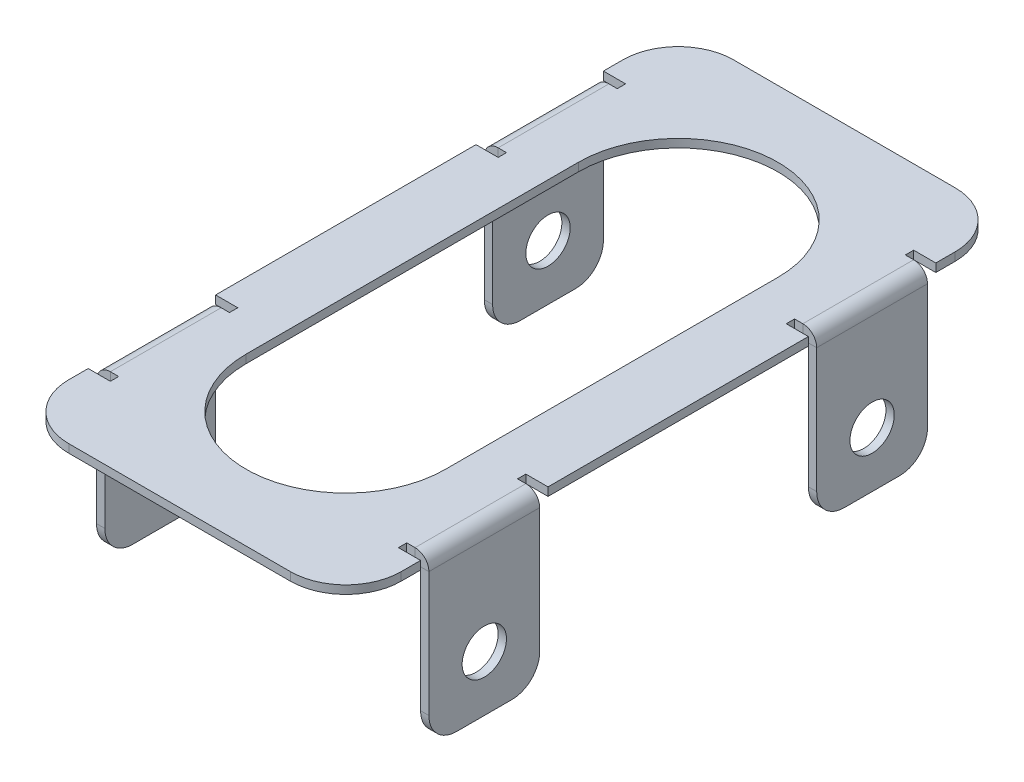
from build123d import *

# Parameters (mm, degrees)
SKETCH1_W                     = 60
SKETCH1_H                     = 120
BASE_FLANGE1_DEPTH            = 1.5
CUT_EXTRUDE1_DEPTH            = 10
BREAK_CORNER1_START           = -1.5
BREAK_CORNER1_DEPTH           = 1.5
EDGE_FLANGE1_STRIP_W          = 8
EDGE_FLANGE1_STRIP_H          = 1.5
EDGE_FLANGE1_STRIP_CUT_DEPTH  = 20
EDGE_FLANGE1_RELIEF_W         = 9.5
EDGE_FLANGE1_RELIEF_H         = 1.5
EDGE_FLANGE1_RELIEF_CUT_DEPTH = 1.5
EDGE_FLANGE1_DEPTH            = 20
SKETCH10_R                    = 4
CUT_EXTRUDE2_DEPTH            = 10
MIRROR2_COPY_1_SKETCH_W       = 8
MIRROR2_COPY_1_SKETCH_H       = 1.5
MIRROR2_COPY_1_DEPTH          = 20
MIRROR2_COPY_2_SKETCH_W       = 9.5
MIRROR2_COPY_2_SKETCH_H       = 1.5
MIRROR2_COPY_2_DEPTH          = 1.5
MIRROR2_COPY_3_DEPTH          = 20
MIRROR2_COPY_4_SKETCH_R       = 4
MIRROR2_COPY_4_DEPTH          = 10
BREAK_CORNER2_START           = -30
BREAK_CORNER2_DEPTH           = 60


# Read off the part's stored shape, not the designer's step: Break-Corner1, Break-Corner2
# Sheet-metal steps are written as plain solids
with BuildPart() as part:
    # Sketch1 → Base-Flange1 (new body)
    with BuildSketch(Plane(origin=(0, 0, 0), x_dir=(1, 0, 0), z_dir=(0, 1, 0))):
        Rectangle(SKETCH1_W, SKETCH1_H)
    extrude(amount=-BASE_FLANGE1_DEPTH)

    # Sketch6 → Cut-Extrude1 (cut)
    with BuildSketch(Plane(origin=(0, 0, 0), x_dir=(1, 0, 0), z_dir=(0, 1, 0))):
        with BuildLine():
            Line((18, 30), (18, -30))
            ThreePointArc((18, -30), (0, -48), (-18, -30))
            Line((-18, -30), (-18, 30))
            ThreePointArc((-18, 30), (0, 48), (18, 30))
        make_face()
    extrude(amount=-CUT_EXTRUDE1_DEPTH, mode=Mode.SUBTRACT)

    # Break-Corner1 outline → Break-Corner1 (cut)
    with BuildSketch(Plane(origin=(0, 0, 0), x_dir=(1, 0, 0), z_dir=(0, 1, 0)).offset(BREAK_CORNER1_START)):
        with BuildLine():
            ThreePointArc((30, -50), (27.071067812, -57.071067812), (20, -60))
            Line((20, -60), (30, -60))
            Line((30, -60), (30, -50))
        make_face()
        with BuildLine():
            Line((-30, -60), (-20, -60))
            ThreePointArc((-20, -60), (-27.071067812, -57.071067812), (-30, -50))
            Line((-30, -50), (-30, -60))
        make_face()
        with BuildLine():
            ThreePointArc((20, 60), (27.071067812, 57.071067812), (30, 50))
            Line((30, 50), (30, 60))
            Line((30, 60), (20, 60))
        make_face()
        with BuildLine():
            Line((-30, 60), (-30, 50))
            ThreePointArc((-30, 50), (-27.071067812, 57.071067812), (-20, 60))
            Line((-20, 60), (-30, 60))
        make_face()
    extrude(amount=BREAK_CORNER1_DEPTH, mode=Mode.SUBTRACT)

    # Edge-Flange1 strip (across the edge) → Edge-Flange1 strip cut (cut)
    with BuildSketch(Plane(origin=(30, -1.5, 25), x_dir=(-1, 0, 0), z_dir=(0, 0, 1))):
        with Locations((-1.5, -0.75)):
            Rectangle(EDGE_FLANGE1_STRIP_W, EDGE_FLANGE1_STRIP_H)
    edge_flange1_strip_cut = extrude(amount=EDGE_FLANGE1_STRIP_CUT_DEPTH, mode=Mode.SUBTRACT)

    # Edge-Flange1 relief (on the sheet) → Edge-Flange1 relief cut (cut)
    with BuildSketch(Plane(origin=(27.5, -1.5, 25), x_dir=(-1, 0, 0), z_dir=(0, -1, 0))):
        with Locations((-3.25, 0.75)):
            Rectangle(EDGE_FLANGE1_RELIEF_W, EDGE_FLANGE1_RELIEF_H)
        with Locations((-3.25, -20.75)):
            Rectangle(EDGE_FLANGE1_RELIEF_W, EDGE_FLANGE1_RELIEF_H)
    edge_flange1_relief_cut = extrude(amount=-EDGE_FLANGE1_RELIEF_CUT_DEPTH, mode=Mode.SUBTRACT)

    # Edge-Flange1 section (across the edge) → Edge-Flange1 (add)
    with BuildSketch(Plane(origin=(30, -1.5, 25), x_dir=(-1, 0, 0), z_dir=(0, 0, 1))):
        with BuildLine():
            Line((0, 1), (0, 28.5))
            Line((0, 28.5), (1.5, 28.5))
            Line((1.5, 28.5), (1.5, 1))
            ThreePointArc((1.5, 1), (1.792893219, 0.292893219), (2.5, 0))
            Line((2.5, 0), (2.5, -1.5))
            ThreePointArc((2.5, -1.5), (0.732233047, -0.767766953), (0, 1))
        make_face()
    edge_flange1 = extrude(amount=EDGE_FLANGE1_DEPTH)

    # Sketch10 → Cut-Extrude2 (cut)
    with BuildSketch(Plane(origin=(30, 0, 0), x_dir=(0, 0, -1), z_dir=(1, 0, 0))):
        with Locations(Location((-35, -20, 0), (0, 0, 90))):
            Circle(SKETCH10_R)
    cut_extrude2 = extrude(amount=-CUT_EXTRUDE2_DEPTH, mode=Mode.SUBTRACT)

    # Mirror1: Edge-Flange1 strip cut, Edge-Flange1 relief cut, Edge-Flange1, Cut-Extrude2 across plane
    add(edge_flange1_strip_cut.mirror(Plane.XY), mode=Mode.SUBTRACT)
    add(edge_flange1_relief_cut.mirror(Plane.XY), mode=Mode.SUBTRACT)
    add(edge_flange1.mirror(Plane.XY))
    add(cut_extrude2.mirror(Plane.XY), mode=Mode.SUBTRACT)

    # Mirror2: Edge-Flange1 strip cut, Edge-Flange1 relief cut, Edge-Flange1, Cut-Extrude2 across plane
    add(edge_flange1_strip_cut.mirror(Plane(origin=(0, 0, 0), x_dir=(0, 0, 1), z_dir=(1, 0, 0))), mode=Mode.SUBTRACT)
    add(edge_flange1_relief_cut.mirror(Plane(origin=(0, 0, 0), x_dir=(0, 0, 1), z_dir=(1, 0, 0))), mode=Mode.SUBTRACT)
    add(edge_flange1.mirror(Plane(origin=(0, 0, 0), x_dir=(0, 0, 1), z_dir=(1, 0, 0))))
    add(cut_extrude2.mirror(Plane(origin=(0, 0, 0), x_dir=(0, 0, 1), z_dir=(1, 0, 0))), mode=Mode.SUBTRACT)

    # Mirror2 copy 1 sketch → Mirror2 copy 1 (cut)
    with BuildSketch(Plane(origin=(-30, -1.5, -25), x_dir=(1, 0, 0), z_dir=(0, 0, -1))):
        with Locations((-1.5, -0.75)):
            Rectangle(MIRROR2_COPY_1_SKETCH_W, MIRROR2_COPY_1_SKETCH_H)
    extrude(amount=MIRROR2_COPY_1_DEPTH, mode=Mode.SUBTRACT)

    # Mirror2 copy 2 sketch → Mirror2 copy 2 (cut)
    with BuildSketch(Plane(origin=(-27.5, -1.5, -25), x_dir=(1, 0, 0), z_dir=(0, -1, 0))):
        with Locations((-3.25, 0.75)):
            Rectangle(MIRROR2_COPY_2_SKETCH_W, MIRROR2_COPY_2_SKETCH_H)
        with Locations((-3.25, -20.75)):
            Rectangle(MIRROR2_COPY_2_SKETCH_W, MIRROR2_COPY_2_SKETCH_H)
    extrude(amount=-MIRROR2_COPY_2_DEPTH, mode=Mode.SUBTRACT)

    # Mirror2 copy 3 sketch → Mirror2 copy 3 (add)
    with BuildSketch(Plane(origin=(-30, -1.5, -25), x_dir=(1, 0, 0), z_dir=(0, 0, -1))):
        with BuildLine():
            Line((0, 1), (0, 28.5))
            Line((0, 28.5), (1.5, 28.5))
            Line((1.5, 28.5), (1.5, 1))
            ThreePointArc((1.5, 1), (1.792893219, 0.292893219), (2.5, 0))
            Line((2.5, 0), (2.5, -1.5))
            ThreePointArc((2.5, -1.5), (0.732233047, -0.767766953), (0, 1))
        make_face()
    extrude(amount=MIRROR2_COPY_3_DEPTH)

    # Mirror2 copy 4 sketch → Mirror2 copy 4 (cut)
    with BuildSketch(Plane.ZY.offset(30)):
        with Locations(Location((-35, -20, 0), (0, 0, 90))):
            Circle(MIRROR2_COPY_4_SKETCH_R)
    extrude(amount=-MIRROR2_COPY_4_DEPTH, mode=Mode.SUBTRACT)

    # Break-Corner2 outline → Break-Corner2 (cut)
    with BuildSketch(Plane.YZ.offset(BREAK_CORNER2_START)):
        with BuildLine():
            Line((-30, 45), (-30, 40))
            ThreePointArc((-30, 40), (-28.535533906, 43.535533906), (-25, 45))
            Line((-25, 45), (-30, 45))
        make_face()
        with BuildLine():
            ThreePointArc((-25, 25), (-28.535533906, 26.464466094), (-30, 30))
            Line((-30, 30), (-30, 25))
            Line((-30, 25), (-25, 25))
        make_face()
        with BuildLine():
            ThreePointArc((-25, -45), (-28.535533906, -43.535533906), (-30, -40))
            Line((-30, -40), (-30, -45))
            Line((-30, -45), (-25, -45))
        make_face()
        with BuildLine():
            Line((-30, -25), (-30, -30))
            ThreePointArc((-30, -30), (-28.535533906, -26.464466094), (-25, -25))
            Line((-25, -25), (-30, -25))
        make_face()
    extrude(amount=BREAK_CORNER2_DEPTH, mode=Mode.SUBTRACT)


solid = part.part
